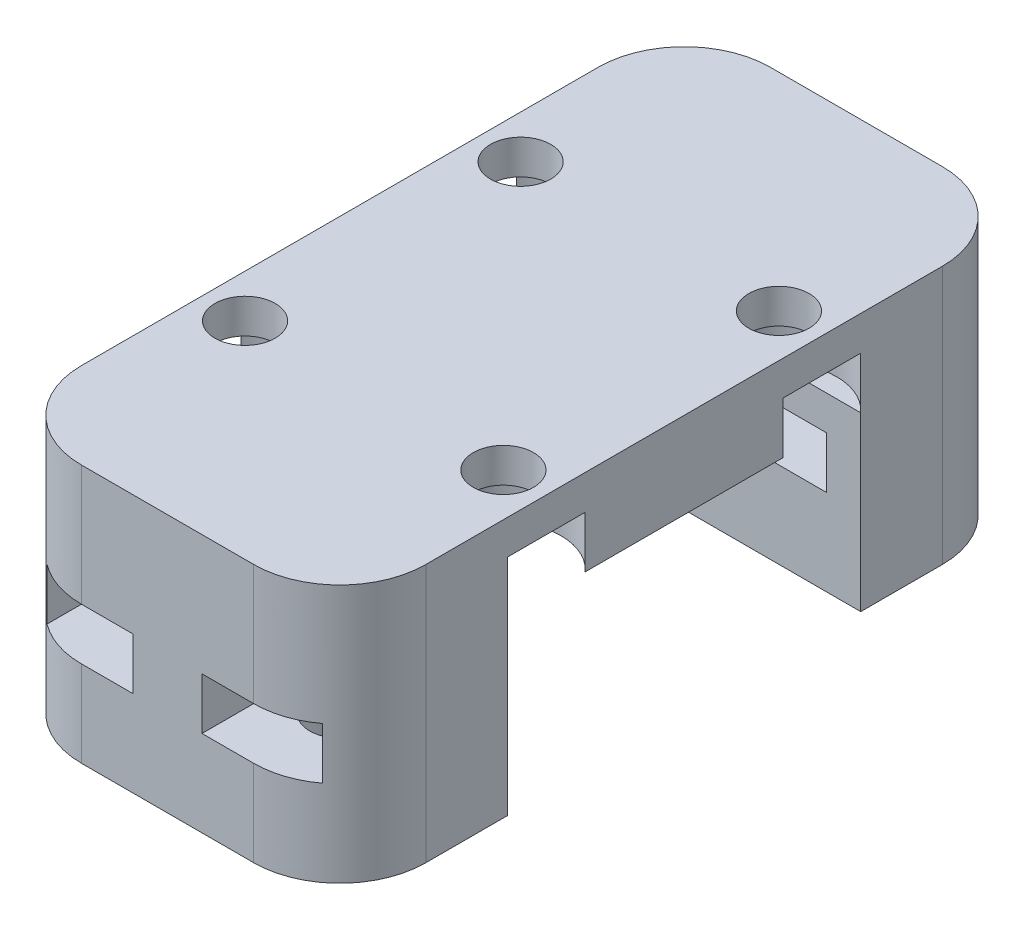
from build123d import *

# Parameters (mm, degrees)
SKETCH1_W           = 20
SKETCH1_H           = 40
BOSS_EXTRUDE1_DEPTH = 5
SKETCH2_W           = 20
SKETCH2_H           = 9.75
BOSS_EXTRUDE2_DEPTH = 10
SKETCH3_R           = 1.75
CUT_EXTRUDE1_DEPTH  = 5
SKETCH4_R           = 3.363406012
CUT_EXTRUDE2_DEPTH  = 3
SKETCH5_R           = 1.75
CUT_EXTRUDE3_DEPTH  = 8
SKETCH6_W           = 6
SKETCH6_H           = 10
CUT_EXTRUDE4_DEPTH  = 3
SKETCH7_R           = 1.75
CUT_EXTRUDE5_DEPTH  = 3
FILLET1_R           = 5


with BuildPart() as part:
    # Sketch1 → Boss-Extrude1 (new body)
    with BuildSketch(Plane(origin=(0, 0, 0), x_dir=(1, 0, 0), z_dir=(0, 1, 0))):
        Rectangle(SKETCH1_W, SKETCH1_H)
    extrude(amount=BOSS_EXTRUDE1_DEPTH)

    # Sketch2 → Boss-Extrude2 (add)
    with BuildSketch(Plane.XZ):
        with Locations((0, 15.125)):
            Rectangle(SKETCH2_W, SKETCH2_H)
        with Locations((0, -15.125)):
            Rectangle(SKETCH2_W, SKETCH2_H)
    extrude(amount=BOSS_EXTRUDE2_DEPTH)

    # Sketch3 → Cut-Extrude1 (cut)
    with BuildSketch(Plane(origin=(0, 5, 0), x_dir=(1, 0, 0), z_dir=(0, 1, 0))):
        with Locations(Location((-7.5, -8, 0), (0, 0, 270))):
            Circle(SKETCH3_R)
        with Locations(Location((-7.5, 8, 0), (0, 0, 270))):
            Circle(SKETCH3_R)
        with Locations(Location((7.5, -8, 0), (0, 0, 270))):
            Circle(SKETCH3_R)
        with Locations(Location((7.5, 8, 0), (0, 0, 270))):
            Circle(SKETCH3_R)
    extrude(amount=-CUT_EXTRUDE1_DEPTH, mode=Mode.SUBTRACT)

    # Sketch4 → Cut-Extrude2 (cut)
    with BuildSketch(Plane.XZ):
        with Locations((7.5, 8)):
            Circle(SKETCH4_R)
        with Locations((-7.5, 8)):
            Circle(SKETCH4_R)
        with Locations((-7.5, -8)):
            Circle(SKETCH4_R)
        with Locations((7.5, -8)):
            Circle(SKETCH4_R)
    extrude(amount=-CUT_EXTRUDE2_DEPTH, mode=Mode.SUBTRACT)

    # Sketch5 → Cut-Extrude3 (cut)
    with BuildSketch(Plane.XZ.offset(10)):
        with Locations(Location((-5, -15, 0), (0, 0, 270))):
            Circle(SKETCH5_R)
        with Locations(Location((5, -15, 0), (0, 0, 270))):
            Circle(SKETCH5_R)
        with Locations(Location((-5, 15, 0), (0, 0, 270))):
            Circle(SKETCH5_R)
        with Locations(Location((5, 15, 0), (0, 0, 270))):
            Circle(SKETCH5_R)
    extrude(amount=-CUT_EXTRUDE3_DEPTH, mode=Mode.SUBTRACT)

    # Sketch6 → Cut-Extrude4 (cut)
    with BuildSketch(Plane.XZ.offset(2)):
        with Locations((-5, -15)):
            Rectangle(SKETCH6_W, SKETCH6_H)
        with Locations((5, -15)):
            Rectangle(SKETCH6_W, SKETCH6_H)
        with Locations((5, 15)):
            Rectangle(SKETCH6_W, SKETCH6_H)
        with Locations((-5, 15)):
            Rectangle(SKETCH6_W, SKETCH6_H)
    extrude(amount=CUT_EXTRUDE4_DEPTH, mode=Mode.SUBTRACT)

    # Sketch7 → Cut-Extrude5 (cut)
    with BuildSketch(Plane.XZ.offset(2)):
        with Locations(Location((-5, -15, 0), (0, 0, 270))):
            Circle(SKETCH7_R)
        with Locations(Location((5, -15, 0), (0, 0, 270))):
            Circle(SKETCH7_R)
        with Locations(Location((5, 15, 0), (0, 0, 270))):
            Circle(SKETCH7_R)
        with Locations(Location((-5, 15, 0), (0, 0, 270))):
            Circle(SKETCH7_R)
    extrude(amount=-CUT_EXTRUDE5_DEPTH, mode=Mode.SUBTRACT)

    # Fillet1
    # the kernel refuses this fillet: 5 mm, written as the material it takes off along each edge
    with BuildSketch(Plane(origin=(-10, 17.5, -20), x_dir=(0, 0, 1), z_dir=(0, -1, 0)), Plane(origin=(10, -22.5, -20), x_dir=(0, 0, 1), z_dir=(0, 1, 0)), Plane(origin=(-10, 17.5, 20), x_dir=(1, 0, 0), z_dir=(0, -1, 0)), Plane(origin=(10, -22.5, 20), x_dir=(-1, 0, 0), z_dir=(0, 1, 0))) as fillet1_piece_1:
        with BuildLine():
            CenterArc((FILLET1_R, -FILLET1_R), FILLET1_R, 90, 90)
            Line((0, -FILLET1_R), (0, 0))
            Line((0, 0), (FILLET1_R, 0))
        make_face()
    extrude(amount=40, mode=Mode.SUBTRACT)


solid = part.part
